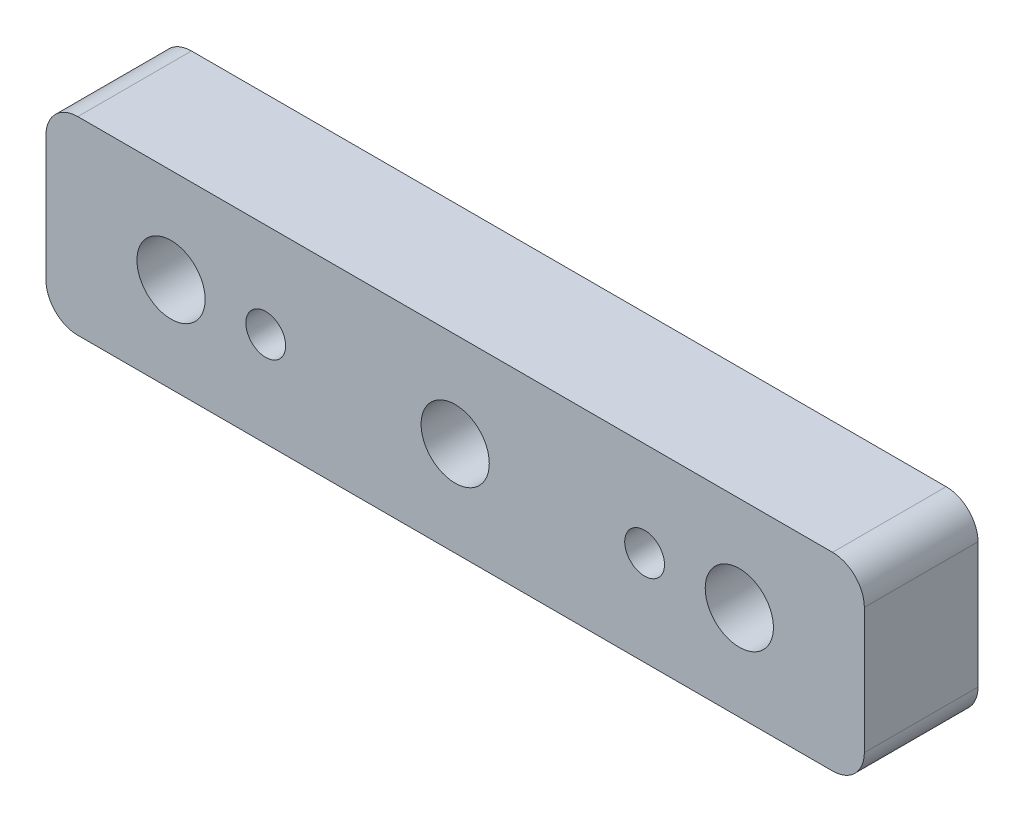
from build123d import *

# Parameters (mm, degrees)
BOSS_EXTRUDE1_DEPTH   = 12
SKETCH3_R             = 3.6
CUT_EXTRUDE2_DEPTH    = 46.937348639
M5X0_8_TAPPED_HOLE1_D = 4.2


with BuildPart() as part:
    # Sketch1 → Boss-Extrude1 (new body)
    with BuildSketch(Plane.XY):
        with BuildLine():
            Line((39.84, -10), (-39.84, -10))
            ThreePointArc((-39.84, -10), (-42.215878785, -9.015878785), (-43.2, -6.64))
            Line((-43.2, -6.64), (-43.2, 6.64))
            ThreePointArc((-43.2, 6.64), (-42.215878785, 9.015878785), (-39.84, 10))
            Line((-39.84, 10), (39.84, 10))
            ThreePointArc((39.84, 10), (42.215878785, 9.015878785), (43.2, 6.64))
            Line((43.2, 6.64), (43.2, -6.64))
            ThreePointArc((43.2, -6.64), (42.215878785, -9.015878785), (39.84, -10))
        make_face()
    extrude(amount=BOSS_EXTRUDE1_DEPTH)

    # Sketch3 → Cut-Extrude2 (cut, through all)
    with BuildSketch(Plane.XY.offset(12)):
        with Locations((-30, 0)):
            Circle(SKETCH3_R)
        with Locations((30, 0)):
            Circle(SKETCH3_R)
        Circle(SKETCH3_R)
    extrude(amount=-CUT_EXTRUDE2_DEPTH, mode=Mode.SUBTRACT)

    # M5x0.8 Tapped Hole1 (through all)
    with Locations(Plane.XY.offset(12)):
        with Locations((-20, 0), (20, 0)):
            Hole(M5X0_8_TAPPED_HOLE1_D / 2)


solid = part.part
